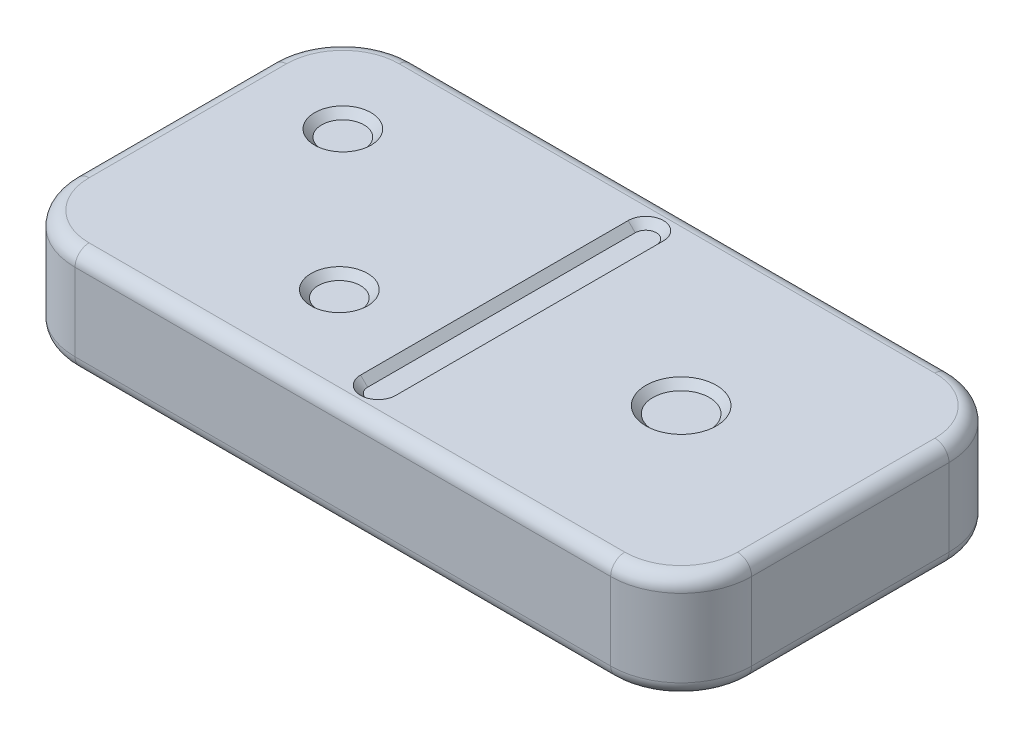
from build123d import *

# Parameters (mm, degrees)
ESQUISSE1_W                = 48
ESQUISSE1_H                = 24
EXTRUSION1_DEPTH           = 7.5
CONG_2_R                   = 5
CONG_5_R                   = 1
CONG_6_R                   = 1
ESQUISSE4_W                = 0.5
ESQUISSE4_H                = 18.982849842
EXTRUSION2_DEPTH           = 0.5
ESQUISSE5_R                = 0.25
EXTRUSION3_DEPTH           = 0.5
CHANFREIN1_SIZE            = 1
ESQUISSE10_R               = 2
EXTRUSION7_DEPTH           = 0.5
EXTRUSION7_DRAFT           = -45
EXTRUSION7_PROFILE_2_DEPTH = 0.5
EXTRUSION7_PROFILE_2_DRAFT = -45
ESQUISSE11_R               = 2.5
EXTRUSION8_DEPTH           = 0.5
EXTRUSION8_DRAFT           = -45


with BuildPart() as part:
    # Esquisse1 → Extrusion1 (new body)
    with BuildSketch(Plane(origin=(0, 0, 0), x_dir=(1, 0, 0), z_dir=(0, 1, 0))):
        with Locations((24, 12)):
            Rectangle(ESQUISSE1_W, ESQUISSE1_H)
    extrude(amount=EXTRUSION1_DEPTH)

    # Congé2
    cong_2_edges = [part.edges().sort_by_distance(p)[0] for p in [
        (0, 3.75, -24),
        (48, 3.75, -24),
        (48, 3.75, 0),
        (0, 3.75, 0),
    ]]
    fillet(cong_2_edges, radius=CONG_2_R)

    # Congé5
    cong_5_edges = [part.edges().sort_by_distance(p)[0] for p in [
        (48, 7.5, -12),
        (24, 7.5, 0),
        (0, 7.5, -12),
        (24, 7.5, -24),
        (1.464466094, 7.5, -22.535533906),
        (1.464466094, 7.5, -1.464466094),
        (46.535533906, 7.5, -22.535533906),
        (46.535533906, 7.5, -1.464466094),
    ]]
    fillet(cong_5_edges, radius=CONG_5_R)

    # Congé6
    cong_6_edges = [part.edges().sort_by_distance(p)[0] for p in [
        (48, 0, -12),
        (0, 0, -12),
        (24, 0, -24),
        (24, 0, 0),
        (1.464466094, 0, -22.535533906),
        (1.464466094, 0, -1.464466094),
        (46.535533906, 0, -22.535533906),
        (46.535533906, 0, -1.464466094),
    ]]
    fillet(cong_6_edges, radius=CONG_6_R)

    # Esquisse4 → Extrusion2 (cut)
    with BuildSketch(Plane(origin=(0, 7.5, 0), x_dir=(1, 0, 0), z_dir=(0, 1, 0))):
        with Locations((24, 12)):
            Rectangle(ESQUISSE4_W, ESQUISSE4_H)
    extrude(amount=-EXTRUSION2_DEPTH, mode=Mode.SUBTRACT)

    # Esquisse5 → Extrusion3 (cut)
    with BuildSketch(Plane(origin=(0, 7.5, 0), x_dir=(1, 0, 0), z_dir=(0, 1, 0))):
        with Locations((24, 21.491424921)):
            Circle(ESQUISSE5_R)
        with Locations((24, 2.508575079)):
            Circle(ESQUISSE5_R)
    extrude(amount=-EXTRUSION3_DEPTH, mode=Mode.SUBTRACT)

    # Chanfrein1
    # the kernel refuses this chamfer: 1 mm, written as the material it takes off along each edge
    with BuildSketch(Plane(origin=(24, 7.5, -21.491424921), x_dir=(1, 0, 0), z_dir=(0, 0, 1))) as chanfrein1_piece_1_section:
        Polygon((0.25 + CHANFREIN1_SIZE, 0), (0.25, -CHANFREIN1_SIZE), (0.25, 0), align=None)
    chanfrein1_piece_1 = revolve(axis=Axis((24, 7.5, -21.491424921), (0, 1, 0)), revolution_arc=180, mode=Mode.PRIVATE)
    chanfrein1_piece_1 = split(chanfrein1_piece_1, bisect_by=Plane(origin=(24, 7, -21.964580549), z_dir=(0, 1, 0)), keep=Keep.TOP, mode=Mode.PRIVATE)
    add(chanfrein1_piece_1, mode=Mode.SUBTRACT)
    with BuildSketch(Plane(origin=(24.25, 7.5, -21.491424921), x_dir=(0.9996219169112968, 0.02749587661058651, 0), z_dir=(0, 0, 1))) as chanfrein1_piece_2_section:
        Polygon((CHANFREIN1_SIZE * 0.999621916911, -CHANFREIN1_SIZE * 0.0274958766106), (-CHANFREIN1_SIZE * 0.0274958766106, -CHANFREIN1_SIZE * 0.999621916911), (0, 0), align=None)
    chanfrein1_piece_2 = extrude(amount=18.982849842, mode=Mode.PRIVATE)
    chanfrein1_piece_2 = split(chanfrein1_piece_2, bisect_by=Plane(origin=(24.643401084, 7, -12), z_dir=(0, 1, 0)), keep=Keep.TOP, mode=Mode.PRIVATE)
    add(chanfrein1_piece_2, mode=Mode.SUBTRACT)
    with BuildSketch(Plane(origin=(24, 7.5, -2.508575079), x_dir=(-1, 0, 0), z_dir=(0, 0, -1))) as chanfrein1_piece_3_section:
        Polygon((0.25 + CHANFREIN1_SIZE, 0), (0.25, -CHANFREIN1_SIZE), (0.25, 0), align=None)
    chanfrein1_piece_3 = revolve(axis=Axis((24, 7.5, -2.508575079), (0, 1, 0)), revolution_arc=180, mode=Mode.PRIVATE)
    chanfrein1_piece_3 = split(chanfrein1_piece_3, bisect_by=Plane(origin=(24, 7, -2.035419451), z_dir=(0, 1, 0)), keep=Keep.TOP, mode=Mode.PRIVATE)
    add(chanfrein1_piece_3, mode=Mode.SUBTRACT)
    with BuildSketch(Plane(origin=(23.75, 7.5, -2.508575079), x_dir=(-0.9996219169112968, 0.02749587661058651, 0), z_dir=(0, 0, -1))) as chanfrein1_piece_4_section:
        Polygon((CHANFREIN1_SIZE * 0.999621916911, -CHANFREIN1_SIZE * 0.0274958766106), (-CHANFREIN1_SIZE * 0.0274958766106, -CHANFREIN1_SIZE * 0.999621916911), (0, 0), align=None)
    chanfrein1_piece_4 = extrude(amount=18.982849842, mode=Mode.PRIVATE)
    chanfrein1_piece_4 = split(chanfrein1_piece_4, bisect_by=Plane(origin=(23.356598916, 7, -12), z_dir=(0, 1, 0)), keep=Keep.TOP, mode=Mode.PRIVATE)
    add(chanfrein1_piece_4, mode=Mode.SUBTRACT)


with BuildPart() as extrusion7_tool:
    # Esquisse10 → Extrusion7 (with draft: the straight prism first)
    with BuildSketch(Plane(origin=(0, 7.5, 0), x_dir=(1, 0, 0), z_dir=(0, 1, 0))):
        with Locations((7, 17)):
            Circle(ESQUISSE10_R)
    extrude(amount=-EXTRUSION7_DEPTH)
    # Extrusion7: the draft: its side faces are tilted about the plane it starts from
    extrusion7_sides = [extrusion7_tool.faces().sort_by_distance(p)[0] for p in [
        (5, 7.25, -17),
    ]]
    draft(extrusion7_sides, Plane(origin=(0, 7.5, 0), x_dir=(1, 0, 0), z_dir=(0, 1, 0)), EXTRUSION7_DRAFT)


with BuildPart() as part_1:
    add(part.part)

    # Extrusion7: cut by extrusion7_tool
    add(extrusion7_tool.part, mode=Mode.SUBTRACT)


with BuildPart() as extrusion7_profile_2_tool:
    # Esquisse10 → Extrusion7 profile 2 (with draft: the straight prism first)
    with BuildSketch(Plane(origin=(0, 7.5, 0), x_dir=(1, 0, 0), z_dir=(0, 1, 0))):
        with Locations((16.75, 7)):
            Circle(ESQUISSE10_R)
    extrude(amount=-EXTRUSION7_PROFILE_2_DEPTH)
    # Extrusion7 profile 2: the draft: its side faces are tilted about the plane it starts from
    extrusion7_profile_2_sides = [extrusion7_profile_2_tool.faces().sort_by_distance(p)[0] for p in [
        (14.75, 7.25, -7),
    ]]
    draft(extrusion7_profile_2_sides, Plane(origin=(0, 7.5, 0), x_dir=(1, 0, 0), z_dir=(0, 1, 0)), EXTRUSION7_PROFILE_2_DRAFT)


with BuildPart() as part_2:
    add(part_1.part)

    # Extrusion7 profile 2: cut by extrusion7_profile_2_tool
    add(extrusion7_profile_2_tool.part, mode=Mode.SUBTRACT)


with BuildPart() as extrusion8_tool:
    # Esquisse11 → Extrusion8 (with draft: the straight prism first)
    with BuildSketch(Plane(origin=(0, 7.5, 0), x_dir=(1, 0, 0), z_dir=(0, 1, 0))):
        with Locations((36, 12)):
            Circle(ESQUISSE11_R)
    extrude(amount=-EXTRUSION8_DEPTH)
    # Extrusion8: the draft: its side faces are tilted about the plane it starts from
    extrusion8_sides = [extrusion8_tool.faces().sort_by_distance(p)[0] for p in [
        (33.5, 7.25, -12),
    ]]
    draft(extrusion8_sides, Plane(origin=(0, 7.5, 0), x_dir=(1, 0, 0), z_dir=(0, 1, 0)), EXTRUSION8_DRAFT)


with BuildPart() as part_3:
    add(part_2.part)

    # Extrusion8: cut by extrusion8_tool
    add(extrusion8_tool.part, mode=Mode.SUBTRACT)


solid = part_3.part
